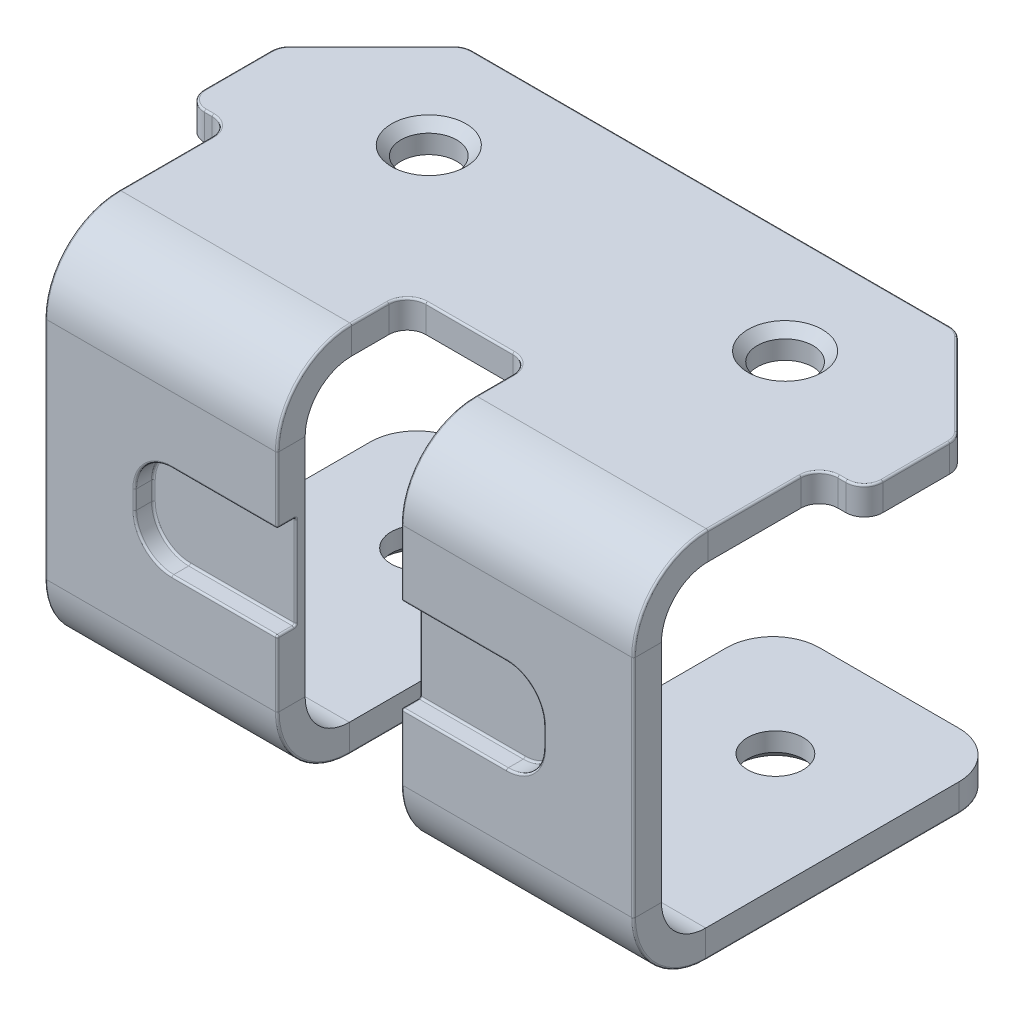
from build123d import *

# Parameters (mm, degrees)
BASE_FLANGE2_DEPTH             = 3
EDGE_FLANGE1_STRIP_W           = 22
EDGE_FLANGE1_STRIP_H           = 3
EDGE_FLANGE1_STRIP_CUT_DEPTH   = 25
EDGE_FLANGE1_STRIP_2_W         = 22
EDGE_FLANGE1_STRIP_2_H         = 3
EDGE_FLANGE1_STRIP_CUT_2_DEPTH = 25
EDGE_FLANGE1_DEPTH             = 25
EDGE_FLANGE1_BEND_DEPTH        = 25
EDGE_FLANGE2_STRIP_W           = 21.52
EDGE_FLANGE2_STRIP_H           = 3
EDGE_FLANGE2_STRIP_CUT_DEPTH   = 25
EDGE_FLANGE2_STRIP_2_W         = 21.52
EDGE_FLANGE2_STRIP_2_H         = 3
EDGE_FLANGE2_STRIP_CUT_2_DEPTH = 25
EDGE_FLANGE2_DEPTH             = 25
EDGE_FLANGE2_BEND_DEPTH        = 25
CHAMFER1_SIZE                  = 10
FILLET1_R                      = 2
FILLET2_R                      = 2
FILLET3_R                      = 5
SKETCH29_R                     = 3
CUT_EXTRUDE1_DEPTH             = 18
SKETCH30_R                     = 3
CUT_EXTRUDE2_DEPTH             = 18
CHAMFER2_SIZE                  = 1
CUT_EXTRUDE3_DEPTH             = 2
FILLET4_R                      = 0.2


# Sheet-metal steps are written as plain solids
with BuildPart() as part:
    # Sketch2 → Base-Flange2 (new body)
    with BuildSketch(Plane(origin=(0, 0, 0), x_dir=(1, 0, 0), z_dir=(0, 1, 0))):
        Polygon((-36.5, -4), (-36.5, 16), (36.5, 16), (36.5, -4), (31.669319917, -4), (31.669319917, -24), (6.669319917, -24), (6.669319917, -10), (-6.669319917, -10), (-6.669319917, -24), (-31.669319917, -24), (-31.669319917, -4), align=None)
    extrude(amount=-BASE_FLANGE2_DEPTH)

    # Edge-Flange1 strip (across the edge) → Edge-Flange1 strip cut (cut)
    with BuildSketch(Plane(origin=(31.669319917, -3, 24), x_dir=(0, 0, -1), z_dir=(-1, 0, 0))):
        with Locations((-3, -1.5)):
            Rectangle(EDGE_FLANGE1_STRIP_W, EDGE_FLANGE1_STRIP_H)
    extrude(amount=EDGE_FLANGE1_STRIP_CUT_DEPTH, mode=Mode.SUBTRACT)

    # Edge-Flange1 strip 2 (across the edge) → Edge-Flange1 strip cut 2 (cut)
    with BuildSketch(Plane(origin=(-6.669319917, -3, 24), x_dir=(0, 0, -1), z_dir=(-1, 0, 0))):
        with Locations((-3, -1.5)):
            Rectangle(EDGE_FLANGE1_STRIP_2_W, EDGE_FLANGE1_STRIP_2_H)
    extrude(amount=EDGE_FLANGE1_STRIP_CUT_2_DEPTH, mode=Mode.SUBTRACT)

    # Edge-Flange1 section (across the edge) → Edge-Flange1 (add)
    with BuildSketch(Plane(origin=(31.669319917, -3, 24), x_dir=(0, 0, -1), z_dir=(-1, 0, 0))):
        with BuildLine():
            Line((0, 5), (0, 37))
            Line((0, 37), (3, 37))
            Line((3, 37), (3, 5))
            ThreePointArc((3, 5), (4.464466094, 1.464466094), (8, 0))
            Line((8, 0), (8, -3))
            ThreePointArc((8, -3), (2.343145751, -0.656854249), (0, 5))
        make_face()
    extrude(amount=EDGE_FLANGE1_DEPTH)

    # Edge-Flange1 section 2 (across the edge) → Edge-Flange1 bend (add)
    with BuildSketch(Plane(origin=(-6.669319917, -3, 24), x_dir=(0, 0, -1), z_dir=(-1, 0, 0))):
        with BuildLine():
            Line((0, 5), (0, 37))
            Line((0, 37), (3, 37))
            Line((3, 37), (3, 5))
            ThreePointArc((3, 5), (4.464466094, 1.464466094), (8, 0))
            Line((8, 0), (8, -3))
            ThreePointArc((8, -3), (2.343145751, -0.656854249), (0, 5))
        make_face()
    extrude(amount=EDGE_FLANGE1_BEND_DEPTH)

    # Edge-Flange2 strip (across the edge) → Edge-Flange2 strip cut (cut)
    with BuildSketch(Plane(origin=(31.669319917, -40, 21), x_dir=(0, 1, 0), z_dir=(-1, 0, 0))):
        with Locations((-3, -1.5)):
            Rectangle(EDGE_FLANGE2_STRIP_W, EDGE_FLANGE2_STRIP_H)
    extrude(amount=EDGE_FLANGE2_STRIP_CUT_DEPTH, mode=Mode.SUBTRACT)

    # Edge-Flange2 strip 2 (across the edge) → Edge-Flange2 strip cut 2 (cut)
    with BuildSketch(Plane(origin=(-6.669319917, -40, 21), x_dir=(0, 1, 0), z_dir=(-1, 0, 0))):
        with Locations((-3, -1.5)):
            Rectangle(EDGE_FLANGE2_STRIP_2_W, EDGE_FLANGE2_STRIP_2_H)
    extrude(amount=EDGE_FLANGE2_STRIP_CUT_2_DEPTH, mode=Mode.SUBTRACT)

    # Edge-Flange2 section (across the edge) → Edge-Flange2 (add)
    with BuildSketch(Plane(origin=(31.669319917, -40, 21), x_dir=(0, 1, 0), z_dir=(-1, 0, 0))):
        with BuildLine():
            Line((0, 4.76), (0, 37))
            Line((0, 37), (3, 37))
            Line((3, 37), (3, 4.76))
            ThreePointArc((3, 4.76), (4.394171722, 1.394171722), (7.76, 0))
            Line((7.76, 0), (7.76, -3))
            ThreePointArc((7.76, -3), (2.272851378, -0.727148622), (0, 4.76))
        make_face()
    extrude(amount=EDGE_FLANGE2_DEPTH)

    # Edge-Flange2 section 2 (across the edge) → Edge-Flange2 bend (add)
    with BuildSketch(Plane(origin=(-6.669319917, -40, 21), x_dir=(0, 1, 0), z_dir=(-1, 0, 0))):
        with BuildLine():
            Line((0, 4.76), (0, 37))
            Line((0, 37), (3, 37))
            Line((3, 37), (3, 4.76))
            ThreePointArc((3, 4.76), (4.394171722, 1.394171722), (7.76, 0))
            Line((7.76, 0), (7.76, -3))
            ThreePointArc((7.76, -3), (2.272851378, -0.727148622), (0, 4.76))
        make_face()
    extrude(amount=EDGE_FLANGE2_BEND_DEPTH)

    # Chamfer1
    chamfer1_edges = [part.edges().sort_by_distance(p)[0] for p in [
        (-36.5, -1.5, -16),
        (36.5, -1.5, -16),
    ]]
    chamfer(chamfer1_edges, length=CHAMFER1_SIZE)

    # Fillet1
    fillet1_edges = [part.edges().sort_by_distance(p)[0] for p in [
        (26.5, -1.5, -16),
        (-26.5, -1.5, -16),
        (-36.5, -1.5, -6),
        (36.5, -1.5, -6),
        (36.5, -1.5, 4),
        (-36.5, -1.5, 4),
    ]]
    fillet(fillet1_edges, radius=FILLET1_R)

    # Fillet2
    fillet2_edges = [part.edges().sort_by_distance(p)[0] for p in [
        (31.669319917, -1.5, 4),
        (6.669319917, -1.5, 10),
        (-6.669319917, -1.5, 10),
        (-31.669319917, -1.5, 4),
    ]]
    fillet(fillet2_edges, radius=FILLET2_R)

    # Fillet3
    fillet3_edges = [part.edges().sort_by_distance(p)[0] for p in [
        (31.669319917, -38.5, -16),
        (6.669319917, -38.5, -16),
        (-6.669319917, -38.5, -16),
        (-31.669319917, -38.5, -16),
    ]]
    fillet(fillet3_edges, radius=FILLET3_R)

    # Sketch29 → Cut-Extrude1 (cut)
    with BuildSketch(Plane(origin=(0, 0, 0), x_dir=(1, 0, 0), z_dir=(0, 1, 0))):
        with BuildLine():
            ThreePointArc((-19.169319917, 7.803829045), (-22.169319917, 4.803829045), (-19.169319917, 1.803829045))
            Line((-19.169319917, 1.803829045), (-19.169319917, 7.803829045))
        make_face()
        with BuildLine():
            Line((-19.169319917, 7.803829045), (-19.169319917, 1.803829045))
            ThreePointArc((-19.169319917, 1.803829045), (-17.047999573, 2.682508701), (-16.169319917, 4.803829045))
            ThreePointArc((-16.169319917, 4.803829045), (-17.047999573, 6.925149389), (-19.169319917, 7.803829045))
        make_face()
        with Locations(Location((19.169319917, 4.803829045, 0), (0, 0, 270))):
            Circle(SKETCH29_R)
    extrude(amount=-CUT_EXTRUDE1_DEPTH, mode=Mode.SUBTRACT)

    # Sketch30 → Cut-Extrude2 (cut)
    with BuildSketch(Plane.XZ.offset(40)):
        with Locations(Location((-19.169319917, -3.76, 0), (0, 0, 270))):
            Circle(SKETCH30_R)
        with Locations(Location((19.169319917, -3.76, 0), (0, 0, 270))):
            Circle(SKETCH30_R)
    extrude(amount=-CUT_EXTRUDE2_DEPTH, mode=Mode.SUBTRACT)

    # Chamfer2
    chamfer2_edges = [part.edges().sort_by_distance(p)[0] for p in [
        (19.169319917, 0, -7.803829045),
        (-19.169319917, 0, -1.803829045),
        (-19.169319917, -40, -0.76),
        (19.169319917, -40, -0.76),
    ]]
    chamfer(chamfer2_edges, length=CHAMFER2_SIZE)

    # Sketch32 → Cut-Extrude3 (cut)
    with BuildSketch(Plane.XY.offset(24)):
        with BuildLine():
            Line((-18, -25.12), (18, -25.12))
            ThreePointArc((18, -25.12), (20.828427125, -23.948427125), (22, -21.12))
            Line((22, -21.12), (22, -19.12))
            ThreePointArc((22, -19.12), (20.828427125, -16.291572875), (18, -15.12))
            Line((18, -15.12), (-18, -15.12))
            ThreePointArc((-18, -15.12), (-20.828427125, -16.291572875), (-22, -19.12))
            Line((-22, -19.12), (-22, -21.12))
            ThreePointArc((-22, -21.12), (-20.828427125, -23.948427125), (-18, -25.12))
        make_face()
    extrude(amount=-CUT_EXTRUDE3_DEPTH, mode=Mode.SUBTRACT)

    # Fillet4
    fillet4_edges = [part.edges().sort_by_distance(p)[0] for p in [
        (31.669319917, -20.12, 24),
        (-6.669319917, -28.68, 24),
        (31.669319917, -37.727148622, 21.727148622),
        (6.669319917, -37.727148622, 21.727148622),
        (6.669319917, -40, 2.62),
        (-6.669319917, -37.727148622, 21.727148622),
        (-31.669319917, -37.727148622, 21.727148622),
        (-31.669319917, -40, 2.62),
        (-36.5, 0, -1.585786438),
        (0, 0, -16),
        (-31.5, 0, -11),
        (-34.084659958, 0, 4),
        (36.5, 0, -1.585786438),
        (31.5, 0, -11),
        (26.43693974, 0, -15.847759065),
        (36.347759065, 0, -5.93693974),
        (35.914213562, 0, 3.414213562),
        (-26.43693974, 0, -15.847759065),
        (-36.347759065, 0, -5.93693974),
        (-35.914213562, 0, 3.414213562),
        (-31.669319917, 0, 11),
        (0, 0, 10),
        (6.669319917, 0, 14),
        (34.084659958, 0, 4),
        (-32.255106355, 0, 4.585786438),
        (-6.083533479, 0, 10.585786438),
        (6.083533479, 0, 10.585786438),
        (32.255106355, 0, 4.585786438),
        (-19.169319917, -40, -16),
        (-6.669319917, -40, 2.62),
        (-8.133786011, -40, -14.535533906),
        (-30.204853823, -40, -14.535533906),
        (19.169319917, -40, -16),
        (31.669319917, -40, 2.62),
        (30.204853823, -40, -14.535533906),
        (8.133786011, -40, -14.535533906),
        (31.669319917, 0, 11),
        (-6.669319917, 0, 14),
        (6.669319917, -28.68, 24),
        (12.334659958, -15.12, 24),
        (12.334659958, -25.12, 24),
        (6.669319917, -20.12, 22),
        (-6.669319917, -11.56, 24),
        (-22, -20.12, 22),
        (-12.334659958, -15.12, 22),
        (12.334659958, -15.12, 22),
        (20.828427125, -23.948427125, 22),
        (-12.334659958, -25.12, 24),
        (-20.828427125, -16.291572875, 24),
        (-20.828427125, -23.948427125, 24),
        (22, -20.12, 24),
        (20.828427125, -16.291572875, 24),
        (-12.334659958, -25.12, 22),
        (-6.669319917, -25.12, 23),
        (6.669319917, -25.12, 23),
        (12.334659958, -25.12, 22),
        (-12.334659958, -15.12, 24),
        (20.828427125, -16.291572875, 22),
        (22, -20.12, 22),
        (20.828427125, -23.948427125, 24),
        (-20.828427125, -23.948427125, 22),
        (-22, -20.12, 24),
        (-20.828427125, -16.291572875, 22),
        (-6.669319917, -15.12, 23),
        (6.669319917, -15.12, 23),
        (-6.669319917, -20.12, 22),
        (31.669319917, -2.343145751, 21.656854249),
        (6.669319917, -2.343145751, 21.656854249),
        (6.669319917, -11.56, 24),
        (-6.669319917, -2.343145751, 21.656854249),
        (-31.669319917, -2.343145751, 21.656854249),
        (-31.669319917, -20.12, 24),
    ]]
    fillet(fillet4_edges, radius=FILLET4_R)


solid = part.part
